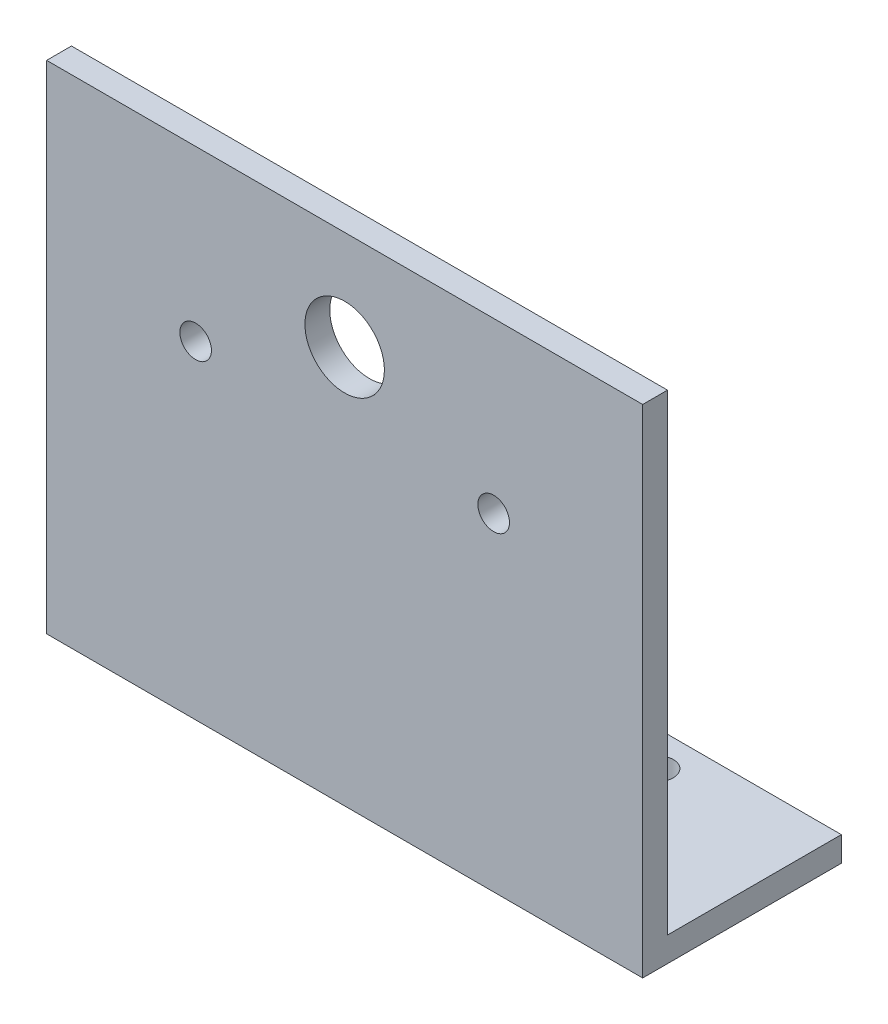
from build123d import *

# Parameters (mm, degrees)
SKETCH1_W                  = 76.2
SKETCH1_H                  = 63.5
SKETCH1_R                  = 5.08
BOSS_EXTRUDE1_DEPTH        = 3.175
F_10_32_TAPPED_HOLE1_D     = 4.0386
F_10_32_TAPPED_HOLE1_DEPTH = 11.938
F_10_32_TAPPED_HOLE1_TIP   = 1.213317848
F_10_32_TAPPED_HOLE2_D     = 4.0386
F_10_32_TAPPED_HOLE2_DEPTH = 11.938
F_10_32_TAPPED_HOLE2_TIP   = 1.213317848
SKETCH10_W                 = 76.2
SKETCH10_H                 = 3.175
BOSS_EXTRUDE2_DEPTH        = 22.225
F_10_32_TAPPED_HOLE3_D     = 4.0386
F_10_32_TAPPED_HOLE3_DEPTH = 11.938
F_10_32_TAPPED_HOLE3_TIP   = 1.213317848
F_10_32_TAPPED_HOLE4_D     = 4.0386
F_10_32_TAPPED_HOLE4_DEPTH = 11.938
F_10_32_TAPPED_HOLE4_TIP   = 1.213317848


with BuildPart() as part:
    # Sketch1 → Boss-Extrude1 (new body)
    with BuildSketch(Plane.XY):
        with Locations((0, -10.16)):
            Rectangle(SKETCH1_W, SKETCH1_H)
        with Locations((0, 8.89)):
            Circle(SKETCH1_R, mode=Mode.SUBTRACT)
    extrude(amount=BOSS_EXTRUDE1_DEPTH)

    # #10-32 Tapped Hole1
    with Locations(Plane.XY.offset(3.175)):
        with Locations((-19.05, 0)):
            Hole(F_10_32_TAPPED_HOLE1_D / 2, depth=F_10_32_TAPPED_HOLE1_DEPTH)
            with Locations((0, 0, -(F_10_32_TAPPED_HOLE1_DEPTH + F_10_32_TAPPED_HOLE1_TIP / 2))):  # 118° drill point
                Cone(0, F_10_32_TAPPED_HOLE1_D / 2, F_10_32_TAPPED_HOLE1_TIP, mode=Mode.SUBTRACT)

    # #10-32 Tapped Hole2
    with Locations(Plane.XY.offset(3.175)):
        with Locations((19.05, 0)):
            Hole(F_10_32_TAPPED_HOLE2_D / 2, depth=F_10_32_TAPPED_HOLE2_DEPTH)
            with Locations((0, 0, -(F_10_32_TAPPED_HOLE2_DEPTH + F_10_32_TAPPED_HOLE2_TIP / 2))):  # 118° drill point
                Cone(0, F_10_32_TAPPED_HOLE2_D / 2, F_10_32_TAPPED_HOLE2_TIP, mode=Mode.SUBTRACT)

    # Sketch10 → Boss-Extrude2 (add)
    with BuildSketch(Plane(origin=(0, 0, 0), x_dir=(-1, 0, 0), z_dir=(0, 0, -1))):
        with Locations((0, -40.3225)):
            Rectangle(SKETCH10_W, SKETCH10_H)
    extrude(amount=BOSS_EXTRUDE2_DEPTH)

    # #10-32 Tapped Hole3
    with Locations(Plane(origin=(0, -38.735, 0), x_dir=(-1, 0, 0), z_dir=(0, 1, 0))):
        with Locations((19.05, -17.78)):
            Hole(F_10_32_TAPPED_HOLE3_D / 2, depth=F_10_32_TAPPED_HOLE3_DEPTH)
            with Locations((0, 0, -(F_10_32_TAPPED_HOLE3_DEPTH + F_10_32_TAPPED_HOLE3_TIP / 2))):  # 118° drill point
                Cone(0, F_10_32_TAPPED_HOLE3_D / 2, F_10_32_TAPPED_HOLE3_TIP, mode=Mode.SUBTRACT)

    # #10-32 Tapped Hole4
    with Locations(Plane(origin=(0, -38.735, 0), x_dir=(-1, 0, 0), z_dir=(0, 1, 0))):
        with Locations((-19.05, -17.78)):
            Hole(F_10_32_TAPPED_HOLE4_D / 2, depth=F_10_32_TAPPED_HOLE4_DEPTH)
            with Locations((0, 0, -(F_10_32_TAPPED_HOLE4_DEPTH + F_10_32_TAPPED_HOLE4_TIP / 2))):  # 118° drill point
                Cone(0, F_10_32_TAPPED_HOLE4_D / 2, F_10_32_TAPPED_HOLE4_TIP, mode=Mode.SUBTRACT)


solid = part.part
